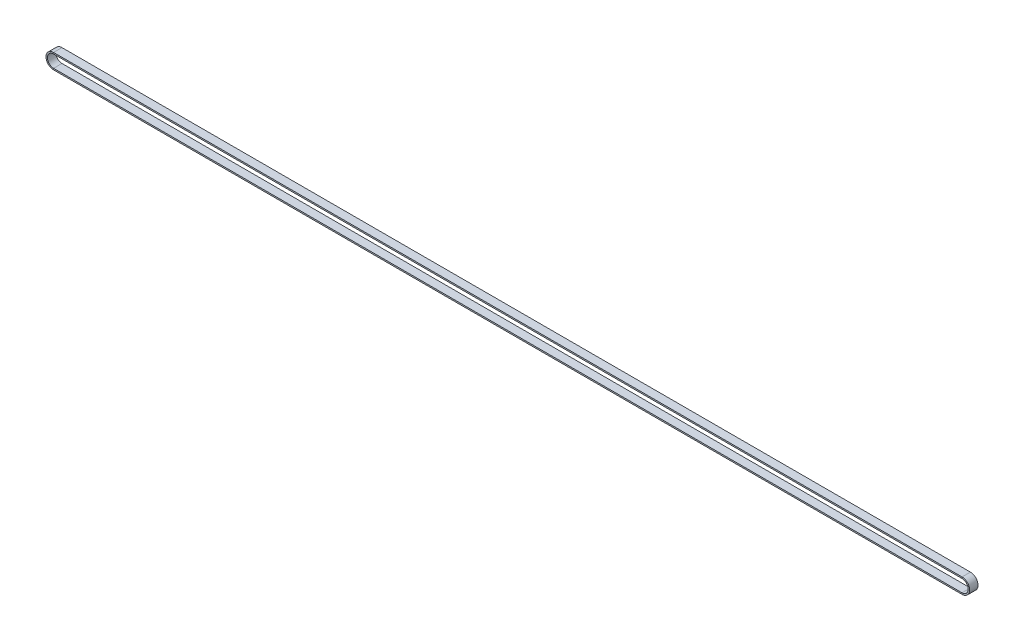
from build123d import *

# Parameters (mm, degrees)
SKETCH3_W = 9
SKETCH3_H = 1.5


with BuildPart() as part:
    # Sweep1: sweep along a path in Sketch2
    with BuildLine(Plane.XY) as sweep1_path:
        Line((-0.000133632, 92.181180312), (-976.331033952, 92.181180312))
        ThreePointArc((-976.331033952, 92.181180312), (-984.470783952, 100.320930312), (-976.331033952, 108.460680312))
        Line((-976.331033952, 108.460680312), (-0.000133632, 108.460680312))
        ThreePointArc((-0.000133632, 108.460680312), (8.139616368, 100.320930312), (-0.000133632, 92.181180312))
    # Sketch3 → Sweep1 (sweep)
    with BuildSketch(Plane(origin=(-0.000133632, 108.460680312, 0), x_dir=(0, 0, -1), z_dir=(1, 0, 0))):
        with Locations((4.5, -0.75)):
            Rectangle(SKETCH3_W, SKETCH3_H)
    sweep(path=sweep1_path.line)


solid = part.part
